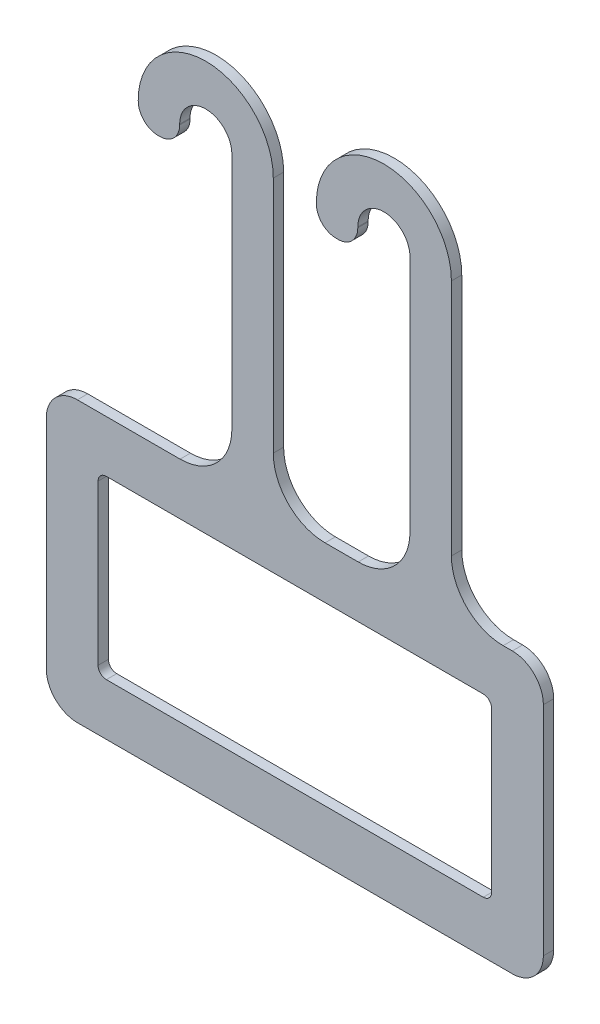
from build123d import *

# Parameters (mm, degrees)
BOSS_EXTRUDE1_DEPTH = 3.175
FILLET1_R           = 6.096


with BuildPart() as part:
    # Sketch1 → Boss-Extrude1 (new body)
    with BuildSketch(Plane.XY):
        with BuildLine():
            Line((-66.675, 42.8625), (-35.179, 42.8625))
            ThreePointArc((-35.179, 42.8625), (-23.953679849, 47.512179849), (-19.304, 58.7375))
            Line((-19.304, 58.7375), (-19.304, 131.7625))
            ThreePointArc((-19.304, 131.7625), (-27.305, 139.7635), (-35.306, 131.7625))
            Line((-35.306, 131.7625), (-35.306, 125.4125))
            Line((-35.306, 125.4125), (-48.006, 125.4125))
            Line((-48.006, 125.4125), (-48.006, 131.7625))
            ThreePointArc((-48.006, 131.7625), (-27.305, 152.4635), (-6.604, 131.7625))
            Line((-6.604, 131.7625), (-6.604, 58.7375))
            ThreePointArc((-6.604, 58.7375), (-1.954320151, 47.512179849), (9.271, 42.8625))
            Line((9.271, 42.8625), (19.431, 42.8625))
            ThreePointArc((19.431, 42.8625), (30.656320151, 47.512179849), (35.306, 58.7375))
            Line((35.306, 58.7375), (35.306, 131.7625))
            ThreePointArc((35.306, 131.7625), (27.305, 139.7635), (19.304, 131.7625))
            Line((19.304, 131.7625), (19.304, 125.4125))
            Line((19.304, 125.4125), (6.604, 125.4125))
            Line((6.604, 125.4125), (6.604, 131.7625))
            ThreePointArc((6.604, 131.7625), (27.305, 152.4635), (48.006, 131.7625))
            Line((48.006, 131.7625), (48.006, 58.7375))
            ThreePointArc((48.006, 58.7375), (52.655679849, 47.512179849), (63.881, 42.8625))
            Line((63.881, 42.8625), (66.675, 42.8625))
            ThreePointArc((66.675, 42.8625), (73.410192091, 40.072692091), (76.2, 33.3375))
            Line((76.2, 33.3375), (76.2, -33.3375))
            ThreePointArc((76.2, -33.3375), (73.410192091, -40.072692091), (66.675, -42.8625))
            Line((66.675, -42.8625), (-66.675, -42.8625))
            ThreePointArc((-66.675, -42.8625), (-73.410192091, -40.072692091), (-76.2, -33.3375))
            Line((-76.2, -33.3375), (-76.2, 33.3375))
            ThreePointArc((-76.2, 33.3375), (-73.410192091, 40.072692091), (-66.675, 42.8625))
        make_face()
        with BuildLine():
            Line((-57.785, 26.9875), (57.785, 26.9875))
            ThreePointArc((57.785, 26.9875), (59.581051224, 26.243551224), (60.325, 24.4475))
            Line((60.325, 24.4475), (60.325, -24.4475))
            ThreePointArc((60.325, -24.4475), (59.581051224, -26.243551224), (57.785, -26.9875))
            Line((57.785, -26.9875), (-57.785, -26.9875))
            ThreePointArc((-57.785, -26.9875), (-59.581051224, -26.243551224), (-60.325, -24.4475))
            Line((-60.325, -24.4475), (-60.325, 24.4475))
            ThreePointArc((-60.325, 24.4475), (-59.581051224, 26.243551224), (-57.785, 26.9875))
        make_face(mode=Mode.SUBTRACT)
    extrude(amount=BOSS_EXTRUDE1_DEPTH)

    # Fillet1
    fillet1_edges = [part.edges().sort_by_distance(p)[0] for p in [
        (19.304, 125.4125, 1.5875),
        (6.604, 125.4125, 1.5875),
        (-35.306, 125.4125, 1.5875),
        (-48.006, 125.4125, 1.5875),
    ]]
    fillet(fillet1_edges, radius=FILLET1_R)


solid = part.part
